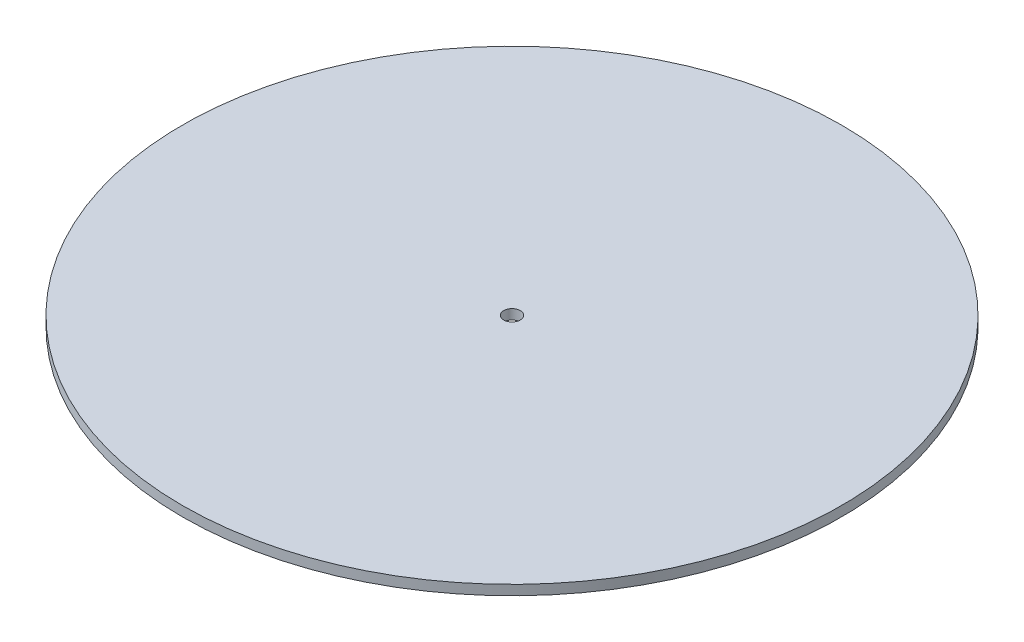
from build123d import *

# Parameters (mm, degrees)
ESQUISSE2_W             = 100
ESQUISSE2_H             = 3
ESQUISSE4_R             = 2.5
ENL_V_MAT_EXTRU_6_DEPTH = 142.453172464


with BuildPart() as part:
    # Esquisse2 → Révolution1 (revolve)
    with BuildSketch(Plane.XY):
        with Locations((50, 1.5)):
            Rectangle(ESQUISSE2_W, ESQUISSE2_H)
    revolve(axis=Axis((0, 55, 0), (0, -1, 0)))

    # Esquisse4 → Enlèv. mat.-Extru.6 (cut, through all)
    with BuildSketch(Plane(origin=(0, 3, 0), x_dir=(1, 0, 0), z_dir=(0, 1, 0))):
        Circle(ESQUISSE4_R)
    extrude(amount=-ENL_V_MAT_EXTRU_6_DEPTH, mode=Mode.SUBTRACT)


solid = part.part
